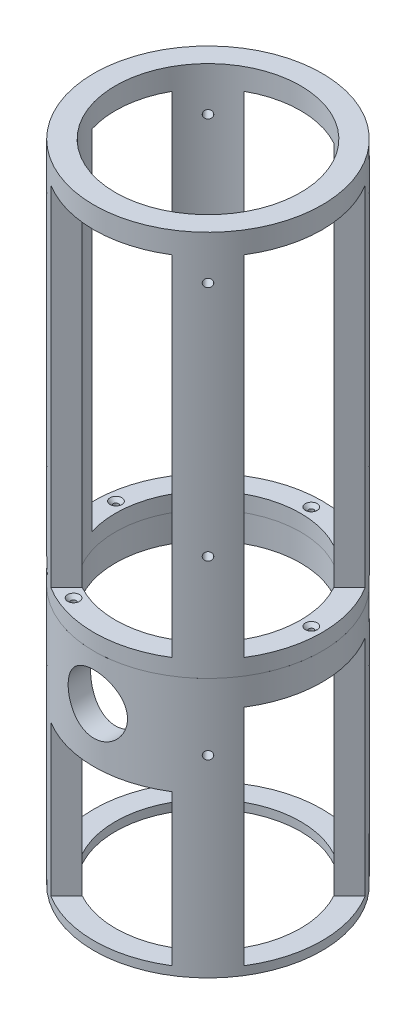
from build123d import *

# Parameters (mm, degrees)
SKETCH1_R               = 67.31
SKETCH1_R_2             = 54.61
BOSS_EXTRUDE1_DEPTH     = 381
CUT_EXTRUDE1_REACH      = 411.651
CUT_EXTRUDE1_END_RADIUS = 54.61
SKETCH2_R               = 17.5
CUT_EXTRUDE2_REACH      = 416.207
CUT_EXTRUDE2_END_RADIUS = 54.61
SKETCH3_R               = 2.413
CIRPATTERN1_COUNT       = 4
CUT_EXTRUDE3_REACH      = 394.711
CUT_EXTRUDE3_END_RADIUS = 67.31
SKETCH4_R               = 1.143
CUT_EXTRUDE4_START      = -218.44
CUT_EXTRUDE4_DEPTH      = 205.74
CUT_EXTRUDE5_DEPTH      = 93.98
CUT_EXTRUDE6_DEPTH      = 43.18
BOSS_EXTRUDE2_DEPTH     = 5.08
SKETCH10_W              = 18.731814035
SKETCH10_H              = 8.89
CUT_EXTRUDE7_DEPTH      = 5.08
SKETCH11_R              = 1.5
CUT_EXTRUDE8_DEPTH      = 20
CHAMFER1_SIZE           = 2
SKETCH12_R              = 2
CUT_EXTRUDE9_DEPTH      = 10.48105


# Read off the part's stored shape, not the designer's step: Intersect1
with BuildPart() as part:
    # Sketch1 → Boss-Extrude1 (new body)
    with BuildSketch(Plane(origin=(0, 0, 0), x_dir=(1, 0, 0), z_dir=(0, 1, 0))):
        with Locations(Location((0, 0, 0), (0, 0, 270))):
            Circle(SKETCH1_R)
        with Locations(Location((0, 0, 0), (0, 0, 270))):
            Circle(SKETCH1_R_2, mode=Mode.SUBTRACT)
    extrude(amount=BOSS_EXTRUDE1_DEPTH)

    # Cut-Extrude1: up to this cylinder (the profile starts outside it)
    cut_extrude1_end = Plane(origin=(0, 126.0221, 0), z_dir=(0, -1, 0)) * Cylinder(CUT_EXTRUDE1_END_RADIUS, 933.522, mode=Mode.PRIVATE)
    # Sketch2 → Cut-Extrude1 (cut, up to the surface)
    with BuildSketch(Plane.XY.offset(67.31), mode=Mode.PRIVATE) as cut_extrude1_sk1:
        with Locations((0, 126.0221)):
            Circle(SKETCH2_R)
    cut_extrude1_tool1 = extrude(cut_extrude1_sk1.sketch, amount=-CUT_EXTRUDE1_REACH, mode=Mode.PRIVATE) - cut_extrude1_end
    add(cut_extrude1_tool1.solids().sort_by_distance((0, 126.0221, 67.31))[0], mode=Mode.SUBTRACT)

    # Cut-Extrude2: up to this cylinder (the profile starts outside it)
    cut_extrude2_end = Plane(origin=(0, 234.442, 0), z_dir=(0, -1, 0)) * Cylinder(CUT_EXTRUDE2_END_RADIUS, 1183.934, mode=Mode.PRIVATE)
    # Sketch3 → Cut-Extrude2 (cut, up to the surface)
    with BuildSketch(Plane(origin=(-47.595357442, 0, 47.595357442), x_dir=(0, -1, 0), z_dir=(-0.7071067811865488, 0, 0.7071067811865464)), mode=Mode.PRIVATE) as cut_extrude2_sk1:
        with Locations(Location((-355.092, 0, 0), (0, 0, 90))):
            Circle(SKETCH3_R)
    cut_extrude2_tool1 = extrude(cut_extrude2_sk1.sketch, amount=-CUT_EXTRUDE2_REACH, mode=Mode.PRIVATE) - cut_extrude2_end
    # Sketch3 → Cut-Extrude2 (cut, up to the surface)
    with BuildSketch(Plane(origin=(-47.595357442, 0, 47.595357442), x_dir=(0, -1, 0), z_dir=(-0.7071067811865488, 0, 0.7071067811865464)), mode=Mode.PRIVATE) as cut_extrude2_sk2:
        with Locations(Location((-215.392, 0, 0), (0, 0, 90))):
            Circle(SKETCH3_R)
    cut_extrude2_tool2 = extrude(cut_extrude2_sk2.sketch, amount=-CUT_EXTRUDE2_REACH, mode=Mode.PRIVATE) - cut_extrude2_end
    # Sketch3 → Cut-Extrude2 (cut, up to the surface)
    with BuildSketch(Plane(origin=(-47.595357442, 0, 47.595357442), x_dir=(0, -1, 0), z_dir=(-0.7071067811865488, 0, 0.7071067811865464)), mode=Mode.PRIVATE) as cut_extrude2_sk3:
        with Locations(Location((-113.792, 0, 0), (0, 0, 90))):
            Circle(SKETCH3_R)
    cut_extrude2_tool3 = extrude(cut_extrude2_sk3.sketch, amount=-CUT_EXTRUDE2_REACH, mode=Mode.PRIVATE) - cut_extrude2_end
    cut_extrude2 = cut_extrude2_tool1.solids().sort_by_distance((-47.595357, 355.092, 47.595357))[0] + cut_extrude2_tool2.solids().sort_by_distance((-47.595357, 215.392, 47.595357))[0] + cut_extrude2_tool3.solids().sort_by_distance((-47.595357, 113.792, 47.595357))[0]
    add(cut_extrude2, mode=Mode.SUBTRACT)

    # CirPattern1: Cut-Extrude2 ×4 about axis
    cirpattern1_axis = Axis((0, 381, 0), (0, -1, 0))
    for i in range(1, CIRPATTERN1_COUNT):
        add(cut_extrude2.rotate(cirpattern1_axis, i * 360 / CIRPATTERN1_COUNT), mode=Mode.SUBTRACT)

    # Cut-Extrude3: up to this cylinder (the profile starts inside it)
    cut_extrude3_end = Plane(origin=(0, 371.475, 0), z_dir=(0, -1, 0)) * Cylinder(CUT_EXTRUDE3_END_RADIUS, 925.042, mode=Mode.PRIVATE)
    # Sketch4 → Cut-Extrude3 (cut, up to the surface)
    with BuildSketch(Plane(origin=(0, 0, 0), x_dir=(0, 0, -1), z_dir=(1, 0, 0)), mode=Mode.PRIVATE) as cut_extrude3_sk1:
        with Locations((-35.56, 371.475)):
            Circle(SKETCH4_R)
    cut_extrude3_tool1 = extrude(cut_extrude3_sk1.sketch, amount=-CUT_EXTRUDE3_REACH, mode=Mode.PRIVATE) & cut_extrude3_end
    add(cut_extrude3_tool1.solids().sort_by_distance((0, 371.475, 35.56))[0], mode=Mode.SUBTRACT)

    # Sketch5 → Cut-Extrude4 (cut)
    with BuildSketch(Plane(origin=(0, 381, 0), x_dir=(1, 0, 0), z_dir=(0, 1, 0)).offset(CUT_EXTRUDE4_START)):
        with BuildLine():
            Line((-47.793440329, 26.42043076), (-57.066637012, 35.693627444))
            ThreePointArc((-57.066637012, 35.693627444), (-66.932080539, 7.12268873), (-63.300334002, -22.884575925))
            Line((-63.300334002, -22.884575925), (-52.138320049, -16.243388884))
            ThreePointArc((-52.138320049, -16.243388884), (-54.32899373, 5.532860046), (-47.793440329, 26.42043076))
        make_face()
        with BuildLine():
            Line((-26.42043076, -47.793440329), (-35.693627444, -57.066637012))
            ThreePointArc((-35.693627444, -57.066637012), (0, -67.31), (35.693627444, -57.066637012))
            Line((35.693627444, -57.066637012), (26.42043076, -47.793440329))
            ThreePointArc((26.42043076, -47.793440329), (0, -54.61), (-26.42043076, -47.793440329))
        make_face()
        with BuildLine():
            ThreePointArc((67.31, 0), (66.054392653, 12.940375233), (62.334415059, 25.397968407))
            Line((62.334415059, 25.397968407), (51.44694702, 18.315669311))
            ThreePointArc((51.44694702, 18.315669311), (53.81342712, 9.293393439), (54.61, 0))
            ThreePointArc((54.61, 0), (52.878407107, -13.64280623), (47.793440329, -26.42043076))
            Line((47.793440329, -26.42043076), (57.066637012, -35.693627444))
            ThreePointArc((57.066637012, -35.693627444), (64.698498581, -18.567185607), (67.31, 0))
        make_face()
        with BuildLine():
            ThreePointArc((35.693627444, 57.066637012), (0, 67.31), (-35.693627444, 57.066637012))
            Line((-35.693627444, 57.066637012), (-26.42043076, 47.793440329))
            ThreePointArc((-26.42043076, 47.793440329), (0, 54.61), (26.42043076, 47.793440329))
            Line((26.42043076, 47.793440329), (35.693627444, 57.066637012))
        make_face()
        with BuildLine():
            ThreePointArc((62.334415059, 25.397968407), (59.922057355, 30.659144514), (57.066637012, 35.693627444))
            Line((57.066637012, 35.693627444), (47.793440329, 26.42043076))
            ThreePointArc((47.793440329, 26.42043076), (49.785393539, 22.442519693), (51.44694702, 18.315669311))
            Line((51.44694702, 18.315669311), (62.334415059, 25.397968407))
        make_face()
    extrude(amount=CUT_EXTRUDE4_DEPTH, mode=Mode.SUBTRACT)

    # Sketch7 → Cut-Extrude5 (cut)
    with BuildSketch(Plane.XZ):
        with BuildLine():
            Line((-47.793440329, 26.42043076), (-57.066637012, 35.693627444))
            ThreePointArc((-57.066637012, 35.693627444), (-67.31, 0), (-57.066637012, -35.693627444))
            Line((-57.066637012, -35.693627444), (-47.793440329, -26.42043076))
            ThreePointArc((-47.793440329, -26.42043076), (-54.61, 0), (-47.793440329, 26.42043076))
        make_face()
        with BuildLine():
            ThreePointArc((35.693627444, 57.066637012), (0, 67.31), (-35.693627444, 57.066637012))
            Line((-35.693627444, 57.066637012), (-26.42043076, 47.793440329))
            ThreePointArc((-26.42043076, 47.793440329), (0, 54.61), (26.42043076, 47.793440329))
            Line((26.42043076, 47.793440329), (35.693627444, 57.066637012))
        make_face()
        with BuildLine():
            ThreePointArc((67.31, 0), (64.698498581, 18.567185607), (57.066637012, 35.693627444))
            Line((57.066637012, 35.693627444), (47.793440329, 26.42043076))
            ThreePointArc((47.793440329, 26.42043076), (52.878407107, 13.64280623), (54.61, 0))
            ThreePointArc((54.61, 0), (52.878407107, -13.64280623), (47.793440329, -26.42043076))
            Line((47.793440329, -26.42043076), (57.066637012, -35.693627444))
            ThreePointArc((57.066637012, -35.693627444), (64.698498581, -18.567185607), (67.31, 0))
        make_face()
        with BuildLine():
            Line((-26.42043076, -47.793440329), (-35.693627444, -57.066637012))
            ThreePointArc((-35.693627444, -57.066637012), (0, -67.31), (35.693627444, -57.066637012))
            Line((35.693627444, -57.066637012), (26.42043076, -47.793440329))
            ThreePointArc((26.42043076, -47.793440329), (0, -54.61), (-26.42043076, -47.793440329))
        make_face()
    extrude(amount=-CUT_EXTRUDE5_DEPTH, mode=Mode.SUBTRACT)

    # Sketch8 → Cut-Extrude6 (cut)
    with BuildSketch(Plane.XZ.offset(-93.98)):
        with BuildLine():
            Line((-26.42043076, -47.793440329), (-35.693627444, -57.066637012))
            ThreePointArc((-35.693627444, -57.066637012), (0, -67.31), (35.693627444, -57.066637012))
            Line((35.693627444, -57.066637012), (26.42043076, -47.793440329))
            ThreePointArc((26.42043076, -47.793440329), (0, -54.61), (-26.42043076, -47.793440329))
        make_face()
        with BuildLine():
            Line((57.066637012, 35.693627444), (47.793440329, 26.42043076))
            ThreePointArc((47.793440329, 26.42043076), (54.61, 0), (47.793440329, -26.42043076))
            Line((47.793440329, -26.42043076), (57.066637012, -35.693627444))
            ThreePointArc((57.066637012, -35.693627444), (67.31, 0), (57.066637012, 35.693627444))
        make_face()
        with BuildLine():
            Line((-57.066637012, -35.693627444), (-47.793440329, -26.42043076))
            ThreePointArc((-47.793440329, -26.42043076), (-54.61, 0), (-47.793440329, 26.42043076))
            Line((-47.793440329, 26.42043076), (-57.066637012, 35.693627444))
            ThreePointArc((-57.066637012, 35.693627444), (-67.31, 0), (-57.066637012, -35.693627444))
        make_face()
    extrude(amount=-CUT_EXTRUDE6_DEPTH, mode=Mode.SUBTRACT)

    # Sketch9 → Boss-Extrude2 (add)
    with BuildSketch(Plane.XZ):
        with BuildLine():
            Line((-47.793440329, 26.42043076), (-57.066637012, 35.693627444))
            ThreePointArc((-57.066637012, 35.693627444), (-67.31, 0), (-57.066637012, -35.693627444))
            Line((-57.066637012, -35.693627444), (-47.793440329, -26.42043076))
            ThreePointArc((-47.793440329, -26.42043076), (-54.61, 0), (-47.793440329, 26.42043076))
        make_face()
        with BuildLine():
            ThreePointArc((67.31, 0), (32.619764229, 58.877729929), (-35.693627444, 57.066637012))
            Line((-35.693627444, 57.066637012), (-26.42043076, 47.793440329))
            ThreePointArc((-26.42043076, 47.793440329), (27.743759444, 47.037601043), (54.61, 0))
            ThreePointArc((54.61, 0), (27.743759444, -47.037601043), (-26.42043076, -47.793440329))
            Line((-26.42043076, -47.793440329), (-35.693627444, -57.066637012))
            ThreePointArc((-35.693627444, -57.066637012), (32.619764229, -58.877729929), (67.31, 0))
        make_face()
    extrude(amount=-BOSS_EXTRUDE2_DEPTH)

    # Sketch10 → Cut-Extrude7 (cut)
    with BuildSketch(Plane(origin=(-47.595357442, 0, 47.595357442), x_dir=(0, -1, 0), z_dir=(-0.7071067811865488, 0, 0.7071067811865464))):
        with Locations((-153.397669931, -3.307034109)):
            Rectangle(SKETCH10_W, SKETCH10_H)
        Polygon((-178.003576949, -3.307034109), (-162.763576949, -12.832034109), (-162.763576949, -7.752034109), (-162.763576949, 1.137965891), (-162.763576949, 6.217965891), align=None)
    extrude(amount=-CUT_EXTRUDE7_DEPTH, mode=Mode.SUBTRACT)

    # Sketch11 → Cut-Extrude8 (cut)
    with BuildSketch(Plane(origin=(0, 162.56, 0), x_dir=(1, 0, 0), z_dir=(0, 1, 0))):
        with Locations(Location((-60.630537134, 6.327774388, 0), (0, 0, 270))):
            Circle(SKETCH11_R)
        with Locations(Location((-23.668195545, -55.65074698, 0), (0, 0, 270))):
            Circle(SKETCH11_R)
        with Locations(Location((0, 60.96, 0), (0, 0, 270))):
            Circle(SKETCH11_R)
        with Locations(Location((60.96, 0, 0), (0, 0, 270))):
            Circle(SKETCH11_R)
    extrude(amount=-CUT_EXTRUDE8_DEPTH, mode=Mode.SUBTRACT)

    # Chamfer1
    chamfer1_edges = [part.edges().sort_by_distance(p)[0] for p in [
        (-60.630537134, 162.56, -7.827774388),
        (-23.668195545, 162.56, 54.15074698),
        (0, 162.56, -62.46),
        (60.96, 162.56, -1.5),
    ]]
    chamfer(chamfer1_edges, length=CHAMFER1_SIZE)


with BuildPart() as body_2:
    # Intersect1: the piece on the far side of the plane
    add(part.part)
    split(bisect_by=Plane(origin=(0, 153.04105, 0), x_dir=(1, 0, 0), z_dir=(0, 1, 0)), keep=Keep.BOTTOM)

    # Sketch12 → Cut-Extrude9 (cut)
    with BuildSketch(Plane(origin=(0, 153.04105, 0), x_dir=(1, 0, 0), z_dir=(0, 1, 0))):
        with Locations(Location((-60.630537134, 6.327774388, 0), (0, 0, 270))):
            Circle(SKETCH12_R)
        with Locations(Location((0, 60.96, 0), (0, 0, 270))):
            Circle(SKETCH12_R)
        with Locations(Location((60.96, 0, 0), (0, 0, 270))):
            Circle(SKETCH12_R)
        with Locations(Location((-23.668195545, -55.65074698, 0), (0, 0, 270))):
            Circle(SKETCH12_R)
    extrude(amount=-CUT_EXTRUDE9_DEPTH, mode=Mode.SUBTRACT)


with BuildPart() as part_1:
    add(part.part)

    # Intersect1
    split(bisect_by=Plane(origin=(0, 153.04105, 0), x_dir=(1, 0, 0), z_dir=(0, 1, 0)), keep=Keep.TOP)


solid = Compound([body_2.part, part_1.part])
